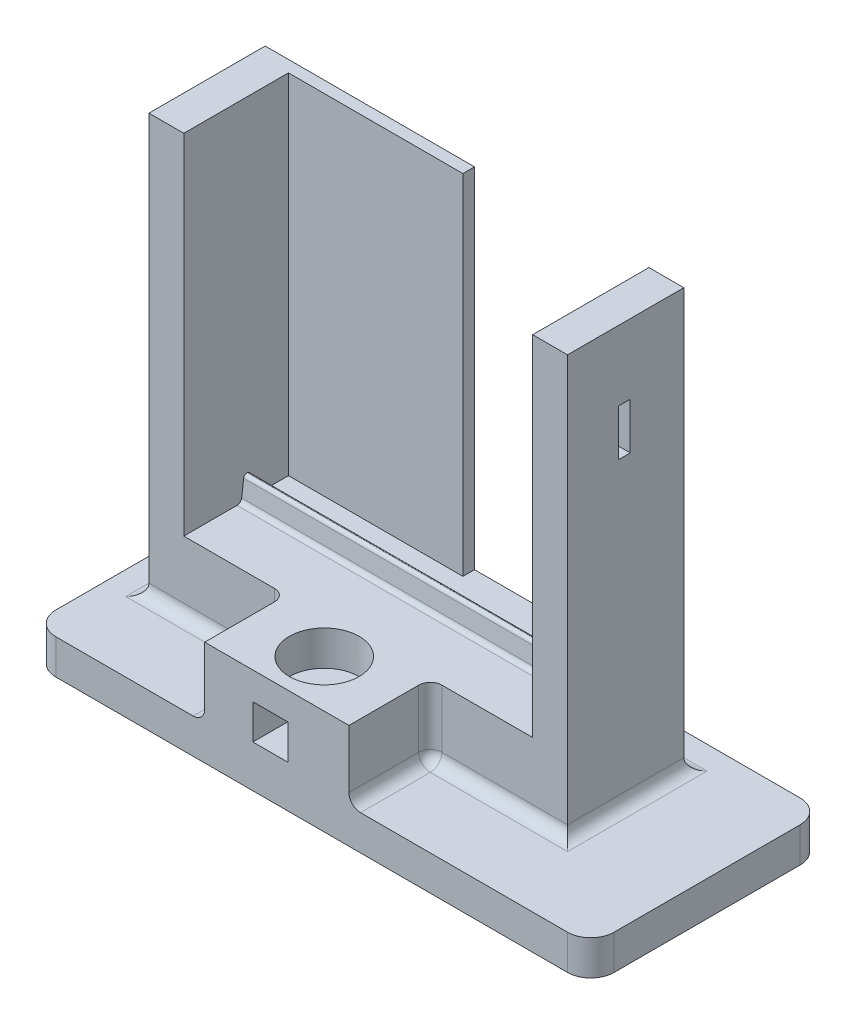
from build123d import *

# Parameters (mm, degrees)
SKETCH1_W            = 240
SKETCH1_H            = 100
BOSS_EXTRUDE1_DEPTH  = 15
SKETCH5_W            = 15
SKETCH5_H            = 50
BOSS_EXTRUDE4_DEPTH  = 180
SKETCH12_W           = 150
SKETCH12_H           = 50
BOSS_EXTRUDE7_DEPTH  = 30
FILLET1_R            = 5
FILLET4_R            = 5
FILLET10_R           = 5
BOSS_EXTRUDE8_DEPTH  = 30
SKETCH17_R           = 15
CUT_EXTRUDE1_DEPTH   = 15
SKETCH18_W           = 15
SKETCH18_H           = 15
CUT_EXTRUDE3_DEPTH   = 15
FILLET11_R           = 5
FILLET12_R           = 5
FILLET13_R           = 5
FILLET14_R           = 5
BOSS_EXTRUDE10_DEPTH = 150
FILLET19_R           = 1.5
FILLET20_R           = 1.5
SKETCH24_W           = 75
SKETCH24_H           = 150
BOSS_EXTRUDE11_DEPTH = 5
FILLET23_R           = 2
FILLET24_R           = 2
FILLET25_R           = 10
FILLET26_R           = 10
FILLET27_R           = 10
FILLET28_R           = 10
SKETCH25_W           = 5
SKETCH25_H           = 20
CUT_EXTRUDE4_DEPTH   = 271.046292328


with BuildPart() as part:
    # Sketch1 → Boss-Extrude1 (new body)
    with BuildSketch(Plane(origin=(0, 0, 0), x_dir=(1, 0, 0), z_dir=(0, 1, 0))):
        Rectangle(SKETCH1_W, SKETCH1_H)
    extrude(amount=BOSS_EXTRUDE1_DEPTH)

    # Sketch5 → Boss-Extrude4 (add)
    with BuildSketch(Plane(origin=(0, 15, 0), x_dir=(1, 0, 0), z_dir=(0, 1, 0))):
        with Locations((-97.5, 10)):
            Rectangle(SKETCH5_W, SKETCH5_H)
        with Locations((67.5, 10)):
            Rectangle(SKETCH5_W, SKETCH5_H)
    extrude(amount=BOSS_EXTRUDE4_DEPTH)

    # Sketch12 → Boss-Extrude7 (add)
    with BuildSketch(Plane(origin=(0, 15, 0), x_dir=(1, 0, 0), z_dir=(0, 1, 0))):
        with Locations((-15, 10)):
            Rectangle(SKETCH12_W, SKETCH12_H)
    extrude(amount=BOSS_EXTRUDE7_DEPTH)

    # Fillet1
    fillet1_edges = [part.edges().sort_by_distance(p)[0] for p in [
        (-105, 15, -10),
    ]]
    fillet(fillet1_edges, radius=FILLET1_R)

    # Fillet4
    fillet4_edges = [part.edges().sort_by_distance(p)[0] for p in [
        (-17.5, 15, -35),
    ]]
    fillet(fillet4_edges, radius=FILLET4_R)

    # Fillet10
    fillet10_edges = [part.edges().sort_by_distance(p)[0] for p in [
        (75, 15, -12.5),
    ]]
    fillet(fillet10_edges, radius=FILLET10_R)

    # Sketch15 → Boss-Extrude8 (add)
    with BuildSketch(Plane(origin=(0, 15, 0), x_dir=(1, 0, 0), z_dir=(0, 1, 0))):
        Polygon((-15, -15), (16, -15), (16, -50), (-46, -50), (-46, -15), align=None)
    extrude(amount=BOSS_EXTRUDE8_DEPTH)

    # Sketch17 → Cut-Extrude1 (cut)
    with BuildSketch(Plane(origin=(0, 45, 0), x_dir=(1, 0, 0), z_dir=(0, 1, 0))):
        with Locations(Location((-15, -29.627354627, 0), (0, 0, 270))):
            Circle(SKETCH17_R)
    extrude(amount=-CUT_EXTRUDE1_DEPTH, mode=Mode.SUBTRACT)

    # Sketch18 → Cut-Extrude3 (cut)
    with BuildSketch(Plane.XY.offset(50)):
        with Locations((-17.79206598, 25.674800875)):
            Rectangle(SKETCH18_W, SKETCH18_H)
    extrude(amount=-CUT_EXTRUDE3_DEPTH, mode=Mode.SUBTRACT)

    # Fillet11
    fillet11_edges = [part.edges().sort_by_distance(p)[0] for p in [
        (48, 15, 15),
    ]]
    fillet(fillet11_edges, radius=FILLET11_R)

    # Fillet12
    fillet12_edges = [part.edges().sort_by_distance(p)[0] for p in [
        (-78, 15, 15),
    ]]
    fillet(fillet12_edges, radius=FILLET12_R)

    # Fillet13
    fillet13_edges = [part.edges().sort_by_distance(p)[0] for p in [
        (16, 15, 35),
        (16, 32.5, 15),
        (16, 16.464466094, 16.464466094),
    ]]
    fillet(fillet13_edges, radius=FILLET13_R)

    # Fillet14
    fillet14_edges = [part.edges().sort_by_distance(p)[0] for p in [
        (-46, 32.5, 15),
        (-46, 15, 35),
        (-46, 16.464466094, 16.464466094),
    ]]
    fillet(fillet14_edges, radius=FILLET14_R)

    # Sketch23 → Boss-Extrude10 (add)
    with BuildSketch(Plane.ZY.offset(-60)):
        Polygon((-9.66, 45), (-14.66, 45), (-13.41, 55), (-10.91, 55), align=None)
    extrude(amount=BOSS_EXTRUDE10_DEPTH)

    # Fillet19
    fillet19_edges = [part.edges().sort_by_distance(p)[0] for p in [
        (-15, 55, -10.91),
    ]]
    fillet(fillet19_edges, radius=FILLET19_R)

    # Fillet20
    # the kernel refuses this fillet: 1.5 mm, written as the material it takes off along each edge
    with BuildSketch(Plane(origin=(60, 55, -13.41), x_dir=(0, 0, 1), z_dir=(-1, 0, 0))) as fillet20_piece_1:
        with BuildLine():
            CenterArc((1.325104128, -1.492553597), FILLET20_R, 95.711432961, 77.16355069)
            Line((-0.163312687, -1.306501496), (-0.193081023, -1.302780453))
            Line((-0.193081023, -1.302780453), (-0.029768336, 0.003721042))
            Line((-0.029768336, 0.003721042), (0, 0.03))
            ThreePointArc((0, 0.03), (0.587913336, 0.03), (1.172841123, 0.029851072))
            Line((1.172841123, 0.029851072), (1.175826672, 0))
        make_face()
    extrude(amount=150, mode=Mode.SUBTRACT)

    # Sketch24 → Boss-Extrude11 (add)
    with BuildSketch(Plane(origin=(0, 0, -35), x_dir=(-1, 0, 0), z_dir=(0, 0, -1))):
        with Locations((52.5, 120)):
            Rectangle(SKETCH24_W, SKETCH24_H)
    extrude(amount=-BOSS_EXTRUDE11_DEPTH)

    # Fillet23
    fillet23_edges = [part.edges().sort_by_distance(p)[0] for p in [
        (-15, 45, -9.66),
    ]]
    fillet(fillet23_edges, radius=FILLET23_R)

    # Fillet24
    fillet24_edges = [part.edges().sort_by_distance(p)[0] for p in [
        (-15, 45, -14.66),
    ]]
    fillet(fillet24_edges, radius=FILLET24_R)

    # Fillet25
    fillet25_edges = [part.edges().sort_by_distance(p)[0] for p in [
        (120, 7.5, 50),
    ]]
    fillet(fillet25_edges, radius=FILLET25_R)

    # Fillet26
    fillet26_edges = [part.edges().sort_by_distance(p)[0] for p in [
        (120, 7.5, -50),
    ]]
    fillet(fillet26_edges, radius=FILLET26_R)

    # Fillet27
    fillet27_edges = [part.edges().sort_by_distance(p)[0] for p in [
        (-120, 7.5, 50),
    ]]
    fillet(fillet27_edges, radius=FILLET27_R)

    # Fillet28
    fillet28_edges = [part.edges().sort_by_distance(p)[0] for p in [
        (-120, 7.5, -50),
    ]]
    fillet(fillet28_edges, radius=FILLET28_R)

    # Sketch25 → Cut-Extrude4 (cut, through all)
    with BuildSketch(Plane.ZY.offset(-60)):
        with Locations((-9.462355362, 155)):
            Rectangle(SKETCH25_W, SKETCH25_H)
    extrude(amount=-CUT_EXTRUDE4_DEPTH, mode=Mode.SUBTRACT)


solid = part.part
